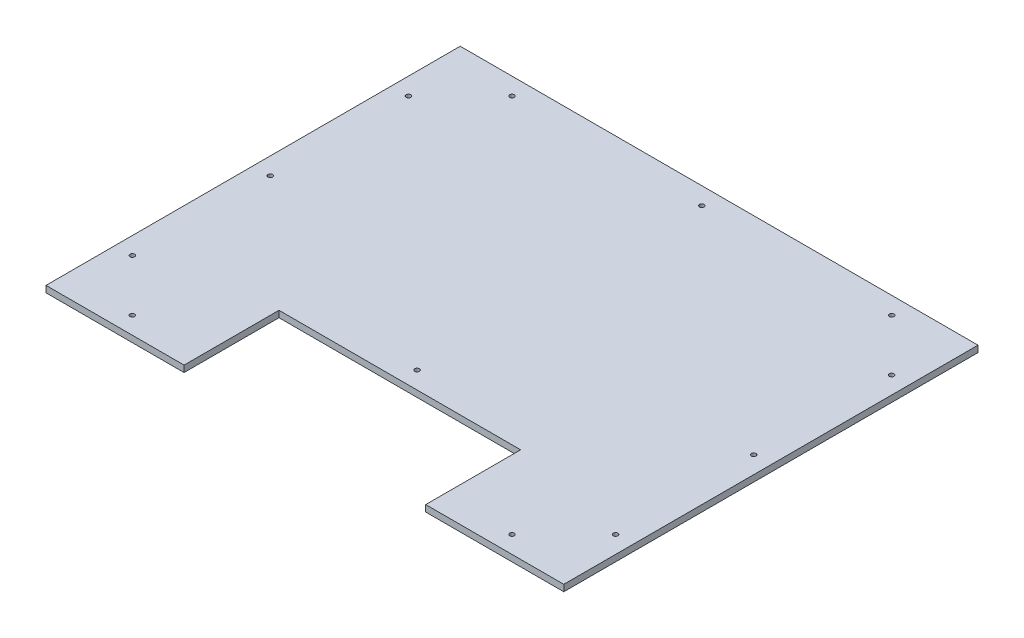
from build123d import *

# Parameters (mm, degrees)
BOSS_EXTRUDE1_DEPTH  = 4.7625
M3_CLEARANCE_HOLE1_D = 3.4


with BuildPart() as part:
    # Sketch1 → Boss-Extrude1 (new body)
    with BuildSketch(Plane(origin=(0, 0, 0), x_dir=(1, 0, 0), z_dir=(0, 1, 0))):
        Polygon((-190.5, -152.4), (-88.9, -152.4), (-88.9, -82.55), (88.9, -82.55), (88.9, -152.4), (190.5, -152.4), (190.5, 152.4), (-190.5, 152.4), align=None)
    extrude(amount=BOSS_EXTRUDE1_DEPTH)

    # M3 Clearance Hole1 (through all)
    with Locations(Plane(origin=(-177.8, 4.7625, 101.6), x_dir=(0, 0, 1), z_dir=(0, 1, 0))):
        with Locations((0, 0), (-101.6, 0), (-203.2, 0), (-241.3, 38.1), (-241.3, 177.8), (-241.3, 317.5), (-203.2, 355.6), (-101.6, 355.6), (0, 355.6), (38.1, 317.5), (38.1, 38.1), (-31.75, 177.8)):
            Hole(M3_CLEARANCE_HOLE1_D / 2)


solid = part.part
